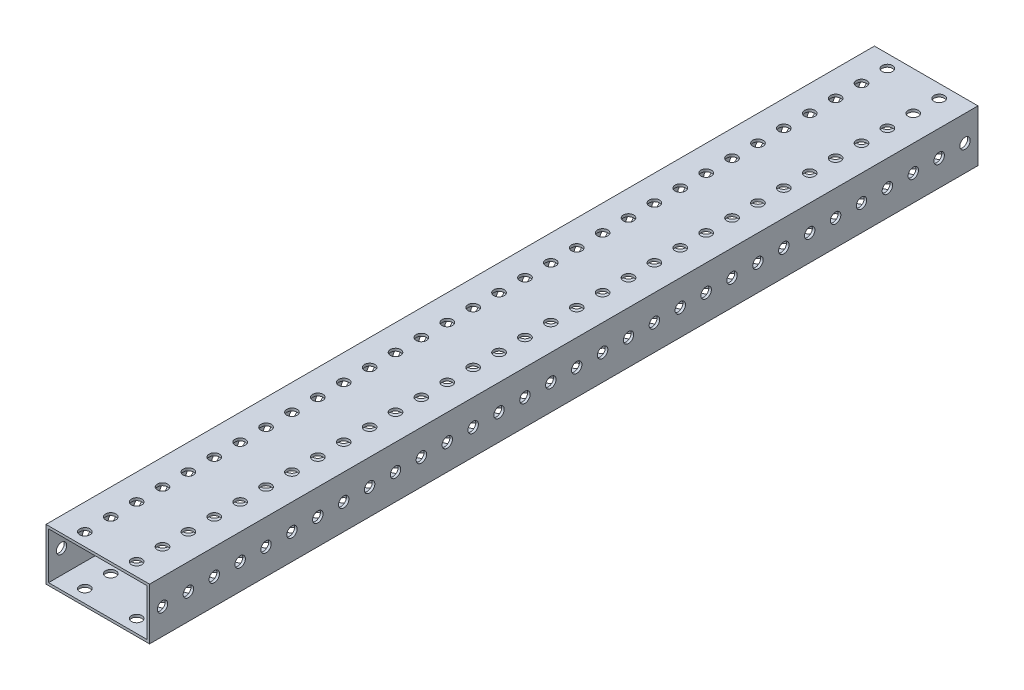
from build123d import *

# Parameters (mm, degrees)
SKETCH1_W           = 50.8
SKETCH1_H           = 406.4
BOSS_EXTRUDE1_DEPTH = 25.4
SKETCH2_W           = 48.26
SKETCH2_H           = 22.86
CUT_EXTRUDE1_DEPTH  = 411.349558304
SKETCH4_R           = 2.5527
CUT_EXTRUDE2_DEPTH  = 411.349558304
SKETCH5_R           = 2.5527
CUT_EXTRUDE3_DEPTH  = 411.349558304


with BuildPart() as part:
    # Sketch1 → Boss-Extrude1 (new body)
    with BuildSketch(Plane(origin=(0, 0, 0), x_dir=(1, 0, 0), z_dir=(0, 1, 0))):
        with Locations((25.4, 203.2)):
            Rectangle(SKETCH1_W, SKETCH1_H)
    extrude(amount=BOSS_EXTRUDE1_DEPTH)

    # Sketch2 → Cut-Extrude1 (cut, through all)
    with BuildSketch(Plane.XY):
        with Locations((25.4, 12.7)):
            Rectangle(SKETCH2_W, SKETCH2_H)
    extrude(amount=-CUT_EXTRUDE1_DEPTH, mode=Mode.SUBTRACT)

    # Sketch4 → Cut-Extrude2 (cut, through all)
    with BuildSketch(Plane(origin=(0, 25.4, 0), x_dir=(1, 0, 0), z_dir=(0, 1, 0))):
        with Locations((12.7, 6.35)):
            Circle(SKETCH4_R)
        with Locations((38.1, 6.35)):
            Circle(SKETCH4_R)
        with Locations((12.7, 19.05)):
            Circle(SKETCH4_R)
        with Locations((38.1, 19.05)):
            Circle(SKETCH4_R)
        with Locations((12.7, 31.75)):
            Circle(SKETCH4_R)
        with Locations((38.1, 31.75)):
            Circle(SKETCH4_R)
        with Locations((12.7, 44.45)):
            Circle(SKETCH4_R)
        with Locations((38.1, 44.45)):
            Circle(SKETCH4_R)
        with Locations((12.7, 57.15)):
            Circle(SKETCH4_R)
        with Locations((38.1, 57.15)):
            Circle(SKETCH4_R)
        with Locations((12.7, 69.85)):
            Circle(SKETCH4_R)
        with Locations((38.1, 69.85)):
            Circle(SKETCH4_R)
        with Locations((12.7, 82.55)):
            Circle(SKETCH4_R)
        with Locations((38.1, 82.55)):
            Circle(SKETCH4_R)
        with Locations((12.7, 95.25)):
            Circle(SKETCH4_R)
        with Locations((38.1, 95.25)):
            Circle(SKETCH4_R)
        with Locations((12.7, 107.95)):
            Circle(SKETCH4_R)
        with Locations((38.1, 107.95)):
            Circle(SKETCH4_R)
        with Locations((12.7, 120.65)):
            Circle(SKETCH4_R)
        with Locations((38.1, 120.65)):
            Circle(SKETCH4_R)
        with Locations((12.7, 133.35)):
            Circle(SKETCH4_R)
        with Locations((38.1, 133.35)):
            Circle(SKETCH4_R)
        with Locations((12.7, 146.05)):
            Circle(SKETCH4_R)
        with Locations((38.1, 146.05)):
            Circle(SKETCH4_R)
        with Locations((12.7, 158.75)):
            Circle(SKETCH4_R)
        with Locations((38.1, 158.75)):
            Circle(SKETCH4_R)
        with Locations((12.7, 171.45)):
            Circle(SKETCH4_R)
        with Locations((38.1, 171.45)):
            Circle(SKETCH4_R)
        with Locations((12.7, 184.15)):
            Circle(SKETCH4_R)
        with Locations((38.1, 184.15)):
            Circle(SKETCH4_R)
        with Locations((12.7, 196.85)):
            Circle(SKETCH4_R)
        with Locations((38.1, 196.85)):
            Circle(SKETCH4_R)
        with Locations((12.7, 209.55)):
            Circle(SKETCH4_R)
        with Locations((38.1, 209.55)):
            Circle(SKETCH4_R)
        with Locations((12.7, 222.25)):
            Circle(SKETCH4_R)
        with Locations((38.1, 222.25)):
            Circle(SKETCH4_R)
        with Locations((12.7, 234.95)):
            Circle(SKETCH4_R)
        with Locations((38.1, 234.95)):
            Circle(SKETCH4_R)
        with Locations((12.7, 247.65)):
            Circle(SKETCH4_R)
        with Locations((38.1, 247.65)):
            Circle(SKETCH4_R)
        with Locations((12.7, 260.35)):
            Circle(SKETCH4_R)
        with Locations((38.1, 260.35)):
            Circle(SKETCH4_R)
        with Locations((12.7, 273.05)):
            Circle(SKETCH4_R)
        with Locations((38.1, 273.05)):
            Circle(SKETCH4_R)
        with Locations((12.7, 285.75)):
            Circle(SKETCH4_R)
        with Locations((38.1, 285.75)):
            Circle(SKETCH4_R)
        with Locations((12.7, 298.45)):
            Circle(SKETCH4_R)
        with Locations((38.1, 298.45)):
            Circle(SKETCH4_R)
        with Locations((12.7, 311.15)):
            Circle(SKETCH4_R)
        with Locations((38.1, 311.15)):
            Circle(SKETCH4_R)
        with Locations((12.7, 323.85)):
            Circle(SKETCH4_R)
        with Locations((38.1, 323.85)):
            Circle(SKETCH4_R)
        with Locations((12.7, 336.55)):
            Circle(SKETCH4_R)
        with Locations((38.1, 336.55)):
            Circle(SKETCH4_R)
        with Locations((12.7, 349.25)):
            Circle(SKETCH4_R)
        with Locations((38.1, 349.25)):
            Circle(SKETCH4_R)
        with Locations((12.7, 361.95)):
            Circle(SKETCH4_R)
        with Locations((38.1, 361.95)):
            Circle(SKETCH4_R)
        with Locations((12.7, 374.65)):
            Circle(SKETCH4_R)
        with Locations((38.1, 374.65)):
            Circle(SKETCH4_R)
        with Locations((12.7, 387.35)):
            Circle(SKETCH4_R)
        with Locations((38.1, 387.35)):
            Circle(SKETCH4_R)
        with Locations((12.7, 400.05)):
            Circle(SKETCH4_R)
        with Locations((38.1, 400.05)):
            Circle(SKETCH4_R)
        with Locations((12.7, 412.75)):
            Circle(SKETCH4_R)
        with Locations((38.1, 412.75)):
            Circle(SKETCH4_R)
        with Locations((12.7, 425.45)):
            Circle(SKETCH4_R)
        with Locations((38.1, 425.45)):
            Circle(SKETCH4_R)
        with Locations((12.7, 438.15)):
            Circle(SKETCH4_R)
        with Locations((38.1, 438.15)):
            Circle(SKETCH4_R)
        with Locations((12.7, 450.85)):
            Circle(SKETCH4_R)
        with Locations((38.1, 450.85)):
            Circle(SKETCH4_R)
        with Locations((12.7, 463.55)):
            Circle(SKETCH4_R)
        with Locations((38.1, 463.55)):
            Circle(SKETCH4_R)
        with Locations((12.7, 476.25)):
            Circle(SKETCH4_R)
        with Locations((38.1, 476.25)):
            Circle(SKETCH4_R)
        with Locations((12.7, 488.95)):
            Circle(SKETCH4_R)
        with Locations((38.1, 488.95)):
            Circle(SKETCH4_R)
        with Locations((12.7, 501.65)):
            Circle(SKETCH4_R)
        with Locations((38.1, 501.65)):
            Circle(SKETCH4_R)
    extrude(amount=-CUT_EXTRUDE2_DEPTH, mode=Mode.SUBTRACT)

    # Sketch5 → Cut-Extrude3 (cut, through all)
    with BuildSketch(Plane.ZY):
        with Locations((-6.35, 12.7)):
            Circle(SKETCH5_R)
        with Locations((-19.05, 12.7)):
            Circle(SKETCH5_R)
        with Locations((-31.75, 12.7)):
            Circle(SKETCH5_R)
        with Locations((-44.45, 12.7)):
            Circle(SKETCH5_R)
        with Locations((-57.15, 12.7)):
            Circle(SKETCH5_R)
        with Locations((-69.85, 12.7)):
            Circle(SKETCH5_R)
        with Locations((-82.55, 12.7)):
            Circle(SKETCH5_R)
        with Locations((-95.25, 12.7)):
            Circle(SKETCH5_R)
        with Locations((-107.95, 12.7)):
            Circle(SKETCH5_R)
        with Locations((-120.65, 12.7)):
            Circle(SKETCH5_R)
        with Locations((-133.35, 12.7)):
            Circle(SKETCH5_R)
        with Locations((-146.05, 12.7)):
            Circle(SKETCH5_R)
        with Locations((-158.75, 12.7)):
            Circle(SKETCH5_R)
        with Locations((-171.45, 12.7)):
            Circle(SKETCH5_R)
        with Locations((-184.15, 12.7)):
            Circle(SKETCH5_R)
        with Locations((-196.85, 12.7)):
            Circle(SKETCH5_R)
        with Locations((-209.55, 12.7)):
            Circle(SKETCH5_R)
        with Locations((-222.25, 12.7)):
            Circle(SKETCH5_R)
        with Locations((-234.95, 12.7)):
            Circle(SKETCH5_R)
        with Locations((-247.65, 12.7)):
            Circle(SKETCH5_R)
        with Locations((-260.35, 12.7)):
            Circle(SKETCH5_R)
        with Locations((-273.05, 12.7)):
            Circle(SKETCH5_R)
        with Locations((-285.75, 12.7)):
            Circle(SKETCH5_R)
        with Locations((-298.45, 12.7)):
            Circle(SKETCH5_R)
        with Locations((-311.15, 12.7)):
            Circle(SKETCH5_R)
        with Locations((-323.85, 12.7)):
            Circle(SKETCH5_R)
        with Locations((-336.55, 12.7)):
            Circle(SKETCH5_R)
        with Locations((-349.25, 12.7)):
            Circle(SKETCH5_R)
        with Locations((-361.95, 12.7)):
            Circle(SKETCH5_R)
        with Locations((-374.65, 12.7)):
            Circle(SKETCH5_R)
        with Locations((-387.35, 12.7)):
            Circle(SKETCH5_R)
        with Locations((-400.05, 12.7)):
            Circle(SKETCH5_R)
        with Locations((-412.75, 12.7)):
            Circle(SKETCH5_R)
        with Locations((-425.45, 12.7)):
            Circle(SKETCH5_R)
        with Locations((-438.15, 12.7)):
            Circle(SKETCH5_R)
        with Locations((-450.85, 12.7)):
            Circle(SKETCH5_R)
        with Locations((-463.55, 12.7)):
            Circle(SKETCH5_R)
        with Locations((-476.25, 12.7)):
            Circle(SKETCH5_R)
        with Locations((-488.95, 12.7)):
            Circle(SKETCH5_R)
        with Locations((-501.65, 12.7)):
            Circle(SKETCH5_R)
    extrude(amount=-CUT_EXTRUDE3_DEPTH, mode=Mode.SUBTRACT)


solid = part.part
